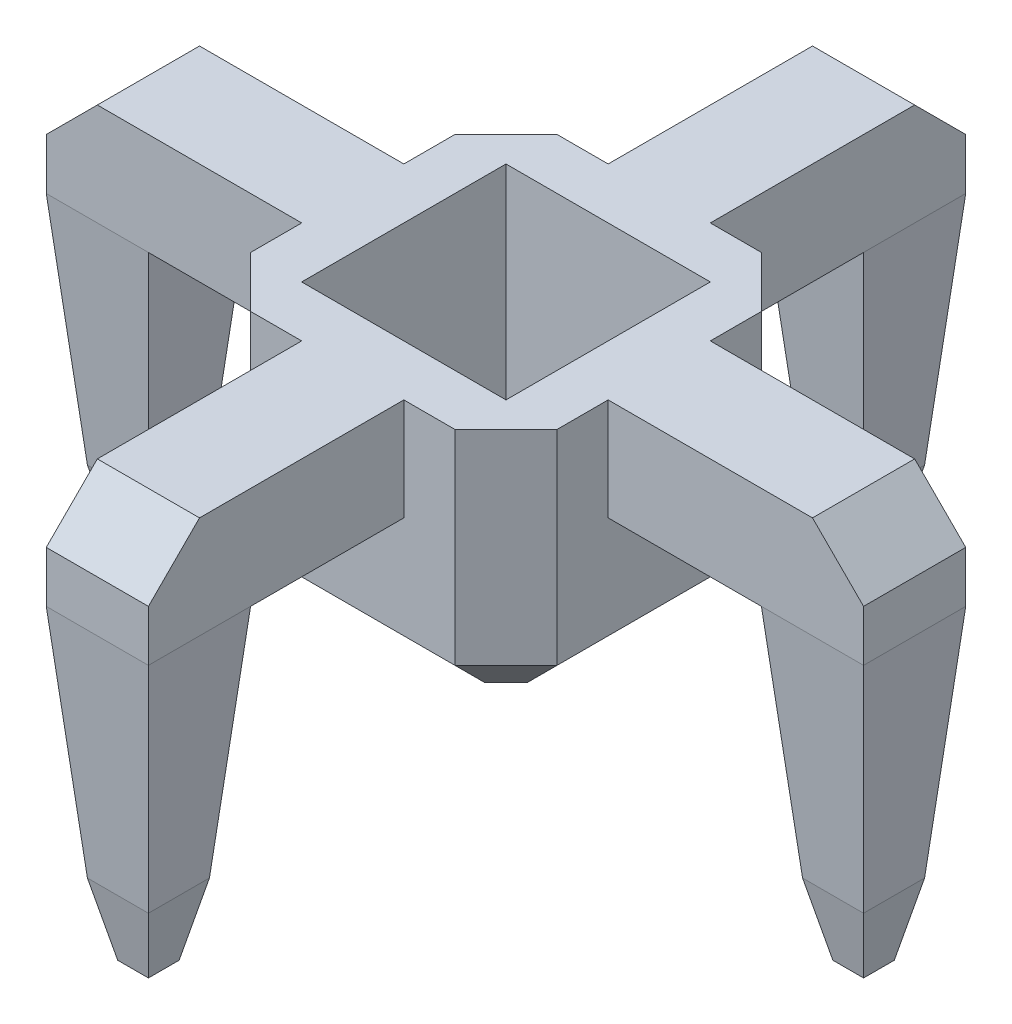
from build123d import *

# Parameters (mm, degrees)
SKETCH1_W         = 30
SKETCH1_H         = 30
CENTER_DEPTH      = 25
SKETCH2_W         = 20
SKETCH2_H         = 20
CENTER_HOLE_DEPTH = 20
SKETCH3_W         = 25
SKETCH3_H         = 10
ARM_DEPTH         = 10
SKETCH5_R         = 2.5
SCREW_HOLE_DEPTH  = 48.16990566
SKETCH7_W         = 10
SKETCH7_H         = 10
LEG_DEPTH         = 30
LEG_TAPER         = 5
CIRPATTERN1_COUNT = 4
CHAMFER1_SIZE     = 5
CHAMFER2_SIZE     = 5
CHAMFER3_SIZE     = 5
CHAMFER4_SIZE     = 7
CHAMFER4_SIZE_2   = 0.872143839


with BuildPart() as part:
    # Sketch1 → center (new body)
    with BuildSketch(Plane(origin=(0, 0, 0), x_dir=(1, 0, 0), z_dir=(0, 1, 0))):
        Rectangle(SKETCH1_W, SKETCH1_H)
    extrude(amount=-CENTER_DEPTH)

    # Sketch2 → center hole (cut)
    with BuildSketch(Plane(origin=(0, 0, 0), x_dir=(1, 0, 0), z_dir=(0, 1, 0))):
        Rectangle(SKETCH2_W, SKETCH2_H)
    extrude(amount=-CENTER_HOLE_DEPTH, mode=Mode.SUBTRACT)

    # Sketch3 → arm (add)
    with BuildSketch(Plane(origin=(0, 0, 0), x_dir=(1, 0, 0), z_dir=(0, 1, 0))):
        with Locations((27.5, 0)):
            Rectangle(SKETCH3_W, SKETCH3_H)
    arm = extrude(amount=-ARM_DEPTH)

    # Sketch5 → screw hole (cut, through all)
    with BuildSketch(Plane(origin=(0, -20, 0), x_dir=(1, 0, 0), z_dir=(0, 1, 0))):
        with Locations(Location((0, 0, 0), (0, 0, 270))):
            Circle(SKETCH5_R)
    extrude(amount=-SCREW_HOLE_DEPTH, mode=Mode.SUBTRACT)

    # Sketch7 → leg (add)
    with BuildSketch(Plane.XZ.offset(10)):
        with Locations((35, 0)):
            Rectangle(SKETCH7_W, SKETCH7_H)
    leg = extrude(amount=LEG_DEPTH, taper=LEG_TAPER)

    # CirPattern1: arm, leg ×4 about axis
    cirpattern1_axis = Axis((0, 0, 0), (0, 1, 0))
    add([arm.rotate(cirpattern1_axis, i * 360 / CIRPATTERN1_COUNT) for i in range(1, CIRPATTERN1_COUNT)])
    add([leg.rotate(cirpattern1_axis, i * 360 / CIRPATTERN1_COUNT) for i in range(1, CIRPATTERN1_COUNT)])

    # Chamfer1
    chamfer1_edges = [part.edges().sort_by_distance(p)[0] for p in [
        (15, -12.5, 15),
        (-15, -12.5, 15),
        (-15, -12.5, -15),
        (15, -12.5, -15),
    ]]
    chamfer(chamfer1_edges, length=CHAMFER1_SIZE)

    # Chamfer2
    chamfer2_edges = [part.edges().sort_by_distance(p)[0] for p in [
        (40, 0, 0),
        (0, 0, -40),
        (-40, 0, 0),
        (0, 0, 40),
    ]]
    chamfer(chamfer2_edges, length=CHAMFER2_SIZE)

    # Chamfer3
    chamfer3_edges = [part.edges().sort_by_distance(p)[0] for p in [
        (-15, -25, 0),
        (0, -25, 15),
        (15, -25, 0),
        (0, -25, -15),
        (12.5, -25, 12.5),
        (12.5, -25, -12.5),
        (-12.5, -25, -12.5),
        (-12.5, -25, 12.5),
    ]]
    chamfer(chamfer3_edges, length=CHAMFER3_SIZE)

    # Chamfer4
    # the kernel refuses this chamfer: 7, 0.872143839 mm, written as the material it takes off along each edge
    with BuildSketch(Plane(origin=(-37.375340094, -40, 20.570322389), x_dir=(-0.08715574274765861, 0.9961946980917454, 0), z_dir=(0, 0, -1)), Plane(origin=(-55.570322389, -40, -2.375340094), x_dir=(0, 0.9961946980917455, -0.08715574274765818), z_dir=(1, 0, 0)), Plane(origin=(-32.624659906, -40, -20.570322389), x_dir=(0.08715574274765861, 0.9961946980917454, 0), z_dir=(0, 0, 1)), Plane(origin=(-14.429677611, -40, 2.375340094), x_dir=(0, 0.9961946980917455, 0.08715574274765825), z_dir=(-1, 0, 0)), Plane(origin=(20.570322389, -40, 37.375340094), x_dir=(0, 0.9961946980917454, 0.08715574274765861), z_dir=(-1, 0, 0)), Plane(origin=(-2.375340094, -40, 55.570322389), x_dir=(-0.08715574274765818, 0.9961946980917455, 0), z_dir=(0, 0, -1)), Plane(origin=(-20.570322389, -40, 32.624659906), x_dir=(0, 0.9961946980917454, -0.08715574274765861), z_dir=(1, 0, 0)), Plane(origin=(2.375340094, -40, 14.429677611), x_dir=(0.08715574274765818, 0.9961946980917455, 0), z_dir=(0, 0, 1)), Plane(origin=(37.375340094, -40, -20.570322389), x_dir=(0.08715574274765861, 0.9961946980917454, 0), z_dir=(0, 0, 1)), Plane(origin=(55.570322389, -40, 2.375340094), x_dir=(0, 0.9961946980917455, 0.08715574274765825), z_dir=(-1, 0, 0)), Plane(origin=(32.624659906, -40, 20.570322389), x_dir=(-0.08715574274765861, 0.9961946980917454, 0), z_dir=(0, 0, -1)), Plane(origin=(14.429677611, -40, -2.375340094), x_dir=(0, 0.9961946980917455, -0.08715574274765825), z_dir=(1, 0, 0)), Plane(origin=(-20.570322389, -40, -37.375340094), x_dir=(0, 0.9961946980917454, -0.08715574274765861), z_dir=(1, 0, 0)), Plane(origin=(2.375340094, -40, -55.570322389), x_dir=(0.08715574274765818, 0.9961946980917455, 0), z_dir=(0, 0, 1)), Plane(origin=(20.570322389, -40, -32.624659906), x_dir=(0, 0.9961946980917454, 0.08715574274765861), z_dir=(-1, 0, 0)), Plane(origin=(-2.375340094, -40, -14.429677611), x_dir=(-0.08715574274765818, 0.9961946980917455, 0), z_dir=(0, 0, -1))) as chamfer4_piece_1:
        Polygon((CHAMFER4_SIZE, 0), (-CHAMFER4_SIZE_2 * 0.0871557427705, CHAMFER4_SIZE_2 * 0.996194698353), (0, 0), align=None)
    extrude(amount=41.140644778, mode=Mode.SUBTRACT)


solid = part.part
